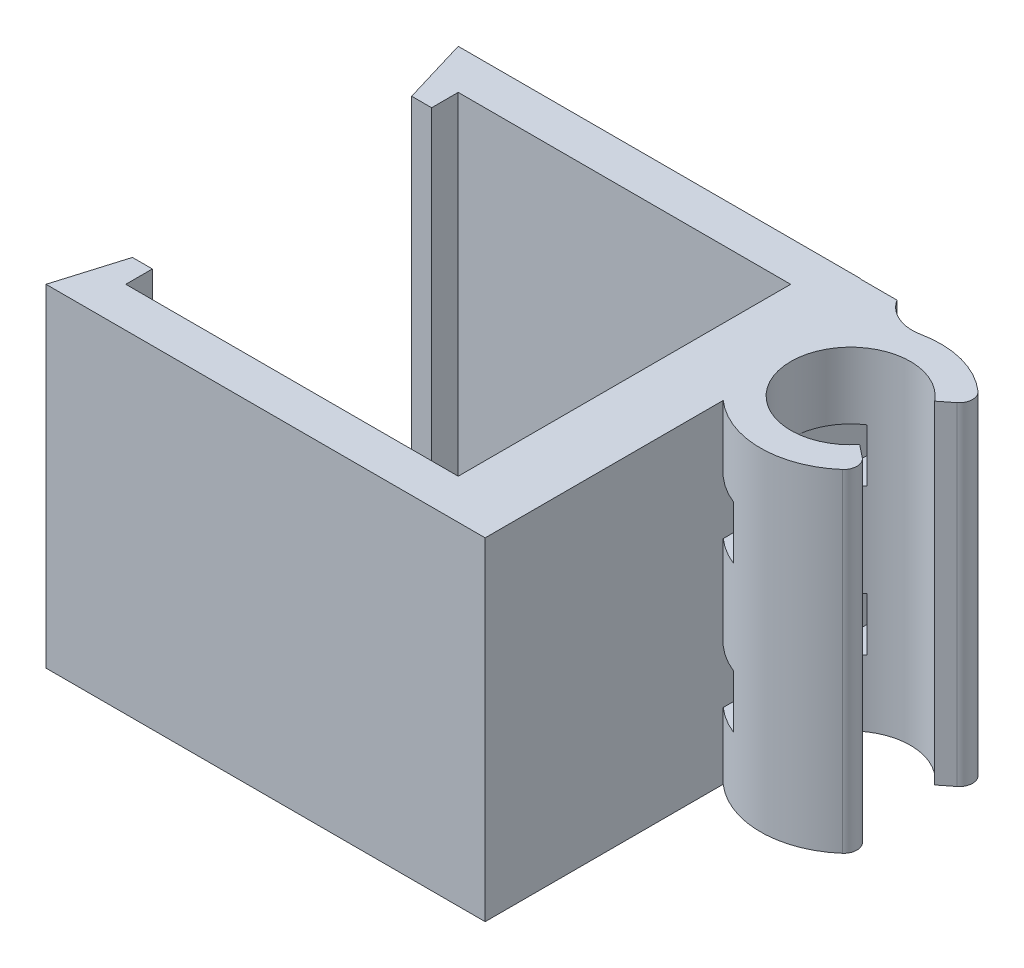
from build123d import *

# Parameters (mm, degrees)
EXTRUDE_1_DEPTH      = 25
CUT_EXTRUDE_4_DEPTH  = 80.457942189
SKETCH_7_W           = 16.60831278
SKETCH_7_H           = 38.473598513
CUT_EXTRUDE_14_DEPTH = 80.457942189
SKETCH_8_W           = 5
SKETCH_8_H           = 30.968526609
EXTRUDE_2_DEPTH      = 25
EXTRUDE_3_DEPTH      = 25
FILLET_2_R           = 3
FILLET_4_R           = 1
SKETCH_10_W          = 2
SKETCH_10_H          = 4
CUT_EXTRUDE_15_DEPTH = 78.792556685
SKETCH_11_W          = 10.357145721
SKETCH_11_H          = 16.019748685
CUT_EXTRUDE_16_DEPTH = 80.457942189


with BuildPart() as part:
    # Эскиз1 → Бобышка-Вытянуть1 (new body)
    with BuildSketch(Plane(origin=(0, 0, 0), x_dir=(1, 0, 0), z_dir=(0, 1, 0))):
        Polygon((-66.825757576, 34.969739794), (-66.825757576, 29.969739794), (-63.825757576, 29.969739794), (-63.825757576, 31.969739794), (-38.825757576, 31.969739794), (-38.825757576, 6.969739794), (-63.825757576, 6.969739794), (-63.825757576, 8.969739794), (-66.825757576, 8.969739794), (-66.825757576, 3.969739794), (-22.123470102, 3.969739794), (-36.579007505, 34.969739794), align=None)
    extrude(amount=EXTRUDE_1_DEPTH)

    # Эскиз3 → Вырез-Вытянуть4 (cut, through all)
    with BuildSketch(Plane.XZ):
        Polygon((-66.825757576, -3.969739794), (-65.325757576, -8.969739794), (-66.825757576, -8.969739794), align=None)
        Polygon((-66.825757576, -29.969739794), (-66.825757576, -34.969739794), (-65.325757576, -29.969739794), align=None)
    extrude(amount=-CUT_EXTRUDE_4_DEPTH, mode=Mode.SUBTRACT)

    # Эскиз7 → Вырез-Вытянуть14 (cut, through all)
    with BuildSketch(Plane(origin=(0, 0, 0), x_dir=(-1, 0, 0), z_dir=(0, -1, 0))):
        with Locations((27.703474463, 20.539743139)):
            Rectangle(SKETCH_7_W, SKETCH_7_H)
    extrude(amount=-CUT_EXTRUDE_14_DEPTH, mode=Mode.SUBTRACT)

    # Эскиз8 → Бобышка-Вытянуть2 (add)
    with BuildSketch(Plane(origin=(0, 0, 0), x_dir=(-1, 0, 0), z_dir=(0, -1, 0))):
        with Locations((36.298943925, 19.454003098)):
            Rectangle(SKETCH_8_W, SKETCH_8_H)
    extrude(amount=-EXTRUDE_2_DEPTH)

    # Эскиз9 → Бобышка-Вытянуть3 (add)
    with BuildSketch(Plane.XZ):
        with BuildLine():
            Line((-25.798943925, -9.121669553), (-24.000865345, -7.695483003))
            ThreePointArc((-24.000865345, -7.695483003), (-36.096342696, -11.954003099), (-24.000865345, -16.212523195))
            Line((-24.000865345, -16.212523195), (-25.798943925, -14.786336644))
            ThreePointArc((-25.798943925, -14.786336644), (-33.80140029, -11.954003099), (-25.798943925, -9.121669553))
        make_face()
        with BuildLine():
            Line((-25.798943925, -24.130682885), (-24.000865345, -22.7126007))
            ThreePointArc((-24.000865345, -22.7126007), (-36.0856317, -26.954003099), (-24.000865345, -31.195405497))
            Line((-24.000865345, -31.195405497), (-25.798943925, -29.777323313))
            ThreePointArc((-25.798943925, -29.777323313), (-33.795735785, -26.954003099), (-25.798943925, -24.130682885))
        make_face()
    extrude(amount=-EXTRUDE_3_DEPTH)

    # Скругление2
    # the kernel refuses this fillet: 3 mm, written as the material it adds along each edge
    with BuildSketch(Plane(origin=(-33.798943925, 25, -6.859434417), x_dir=(0, 0, 1), z_dir=(0, -1, 0))) as fillet_2_piece_1:
        with BuildLine():
            CenterArc((4.502629254, -2.529514158), FILLET_2_R, 122.523458888, 69.079199353)
            Line((1.563931496, -3.132884263), (1.505157541, -3.144951665))
            ThreePointArc((1.505157541, -3.144951665), (0.933475042, -1.490808901), (-0.044969279, -0.039721077))
            Line((-0.044969279, -0.039721077), (0, 0.06))
            ThreePointArc((0, 0.06), (1.444847312, 0.06), (2.85743593, 0.050590283))
            Line((2.85743593, 0.050590283), (2.889694623, 0))
        make_face()
    extrude(amount=25)
    with BuildSketch(Plane(origin=(-33.798943925, 25, -32.034271886), x_dir=(0, 0, -1), z_dir=(0, -1, 0))) as fillet_2_piece_2:
        with BuildLine():
            CenterArc((4.507255062, 2.535656843), FILLET_2_R, 168.421178081, 69.274223823)
            Line((1.568306542, 3.137804332), (1.509527572, 3.149847282))
            ThreePointArc((1.509527572, 3.149847282), (0.936720457, 1.492647534), (-0.044913828, 0.039783766))
            Line((-0.044913828, 0.039783766), (0, -0.06))
            ThreePointArc((0, -0.06), (1.451997259, -0.06), (2.871929307, -0.050713137))
            Line((2.871929307, -0.050713137), (2.903994517, 0))
        make_face()
    extrude(amount=25)

    # Скругление4
    fillet_4_edges = [part.edges().sort_by_distance(p)[0] for p in [
        (-24.000865345, 12.5, -7.695483003),
        (-24.000865345, 12.5, -16.212523195),
        (-24.000865345, 12.5, -22.7126007),
        (-24.000865345, 12.5, -31.195405497),
    ]]
    fillet(fillet_4_edges, radius=FILLET_4_R)

    # Эскиз10 → Вырез-Вытянуть15 (cut, through all)
    with BuildSketch(Plane.XY.offset(-3.969739794)):
        with Locations((-32.798943925, 18)):
            Rectangle(SKETCH_10_W, SKETCH_10_H)
        with Locations((-32.798943925, 7)):
            Rectangle(SKETCH_10_W, SKETCH_10_H)
    extrude(amount=-CUT_EXTRUDE_15_DEPTH, mode=Mode.SUBTRACT)

    # Эскиз11 → Вырез-Вытянуть16 (cut, through all)
    with BuildSketch(Plane.XZ):
        with Locations((-28.620371065, -11.979614137)):
            Rectangle(SKETCH_11_W, SKETCH_11_H)
    extrude(amount=-CUT_EXTRUDE_16_DEPTH, mode=Mode.SUBTRACT)


solid = part.part
